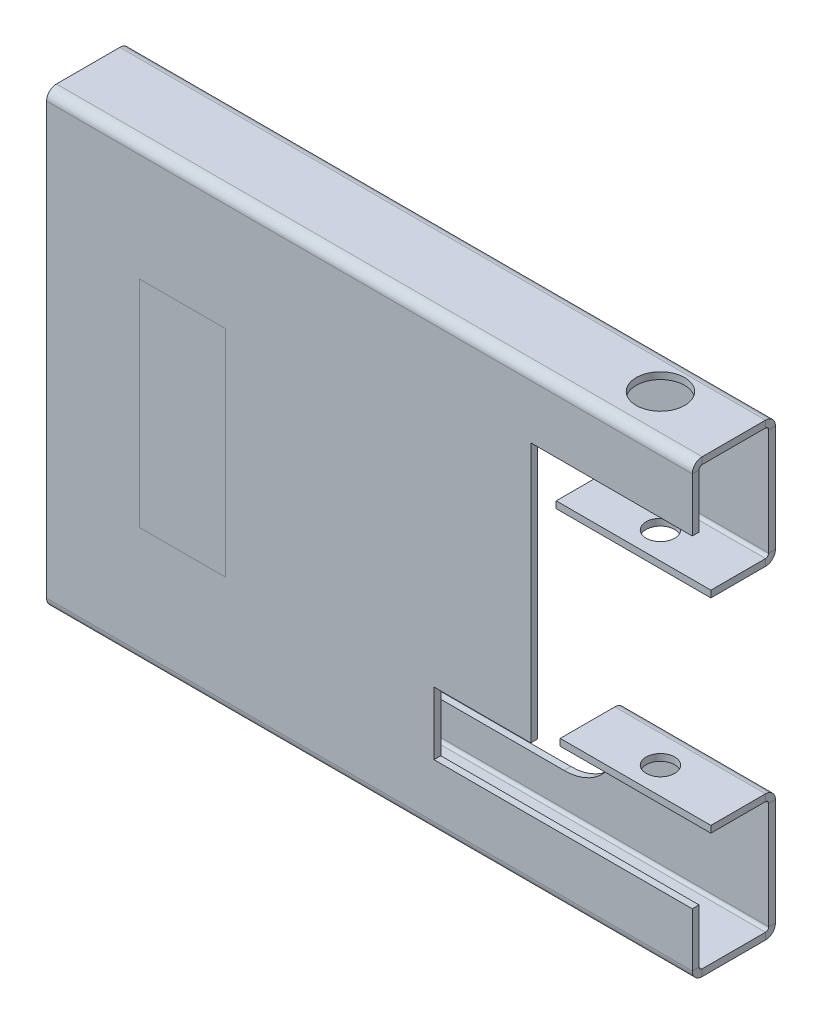
from build123d import *

# Parameters (mm, degrees)
SKETCH1_W                      = 152.4
SKETCH1_H                      = 101.6
BASE_FLANGE1_DEPTH             = 1.6002
EDGE_FLANGE1_DEPTH             = 152.4
EDGE_FLANGE2_DEPTH             = 152.4
CUT_EXTRUDE1_DEPTH             = 95.949783169
EDGE_FLANGE7_STRIP_W           = 7.874
EDGE_FLANGE7_STRIP_H           = 1.6002
EDGE_FLANGE7_STRIP_CUT_DEPTH   = 152.4
EDGE_FLANGE7_DEPTH             = 152.4
EDGE_FLANGE8_STRIP_W           = 7.874
EDGE_FLANGE8_STRIP_H           = 1.6002
EDGE_FLANGE8_STRIP_CUT_DEPTH   = 152.4
EDGE_FLANGE8_DEPTH             = 152.4
SKETCH35_W                     = 35.56
SKETCH35_H                     = 1.6002
BOSS_EXTRUDE1_DEPTH            = 19.7358
EDGE_FLANGE9_STRIP_W           = 7.874
EDGE_FLANGE9_STRIP_H           = 1.6002
EDGE_FLANGE9_STRIP_CUT_DEPTH   = 35.56
EDGE_FLANGE9_DEPTH             = 35.56
SKETCH39_W                     = 36.50996
SKETCH39_H                     = 1.6002
BOSS_EXTRUDE2_DEPTH            = 19.7358
EDGE_FLANGE10_STRIP_W          = 7.874
EDGE_FLANGE10_STRIP_H          = 1.6002
EDGE_FLANGE10_STRIP_CUT_DEPTH  = 36.50996
EDGE_FLANGE10_DEPTH            = 36.50996
CUT_EXTRUDE2_REACH             = 111.661
SKETCH43_R                     = 3.37312
CUT_EXTRUDE2_DIRECTION_2_REACH = 111.661
FILLET1_R                      = 12.7
SKETCH45_R                     = 5.715
CUT_EXTRUDE3_DEPTH             = 1.6002


# Sheet-metal steps are written as plain solids
with BuildPart() as part:
    # Sketch1 → Base-Flange1 (new body)
    with BuildSketch(Plane.XY):
        Rectangle(SKETCH1_W, SKETCH1_H)
    extrude(amount=-BASE_FLANGE1_DEPTH)

    # Edge-Flange1 section (across the edge) → Edge-Flange1 (add)
    with BuildSketch(Plane(origin=(-76.2, 51.5366, -1.6002), x_dir=(0, -1, 0), z_dir=(1, 0, 0))):
        with BuildLine():
            Line((-1.6002, 0.7366), (-1.6002, 18.034))
            Line((-1.6002, 18.034), (0, 18.034))
            Line((0, 18.034), (0, 0.7366))
            ThreePointArc((0, 0.7366), (0.215745145, 0.215745145), (0.7366, 0))
            Line((0.7366, 0), (0.7366, -1.6002))
            ThreePointArc((0.7366, -1.6002), (-0.915767126, -0.915767126), (-1.6002, 0.7366))
        make_face()
    extrude(amount=EDGE_FLANGE1_DEPTH)

    # Edge-Flange2 section (across the edge) → Edge-Flange2 (add)
    with BuildSketch(Plane(origin=(76.2, -51.5366, -1.6002), x_dir=(0, 1, 0), z_dir=(-1, 0, 0))):
        with BuildLine():
            Line((-1.6002, 0.7366), (-1.6002, 18.034))
            Line((-1.6002, 18.034), (0, 18.034))
            Line((0, 18.034), (0, 0.7366))
            ThreePointArc((0, 0.7366), (0.215745145, 0.215745145), (0.7366, 0))
            Line((0.7366, 0), (0.7366, -1.6002))
            ThreePointArc((0.7366, -1.6002), (-0.915767126, -0.915767126), (-1.6002, 0.7366))
        make_face()
    extrude(amount=EDGE_FLANGE2_DEPTH)

    # Sketch14 → Cut-Extrude1 (cut, through all)
    with BuildSketch(Plane.XY):
        Polygon((76.2, -38.1), (76.2, 38.1), (38.1, 38.1), (38.1, -23.241), (15.24, -23.241), (15.24, -38.1), align=None)
    extrude(amount=-CUT_EXTRUDE1_DEPTH, mode=Mode.SUBTRACT)

    # Edge-Flange7 strip (across the edge) → Edge-Flange7 strip cut (cut)
    with BuildSketch(Plane(origin=(76.2, -51.5366, -19.6342), x_dir=(0, 0, 1), z_dir=(-1, 0, 0))):
        with Locations((-1.6002, -0.8001)):
            Rectangle(EDGE_FLANGE7_STRIP_W, EDGE_FLANGE7_STRIP_H)
    extrude(amount=EDGE_FLANGE7_STRIP_CUT_DEPTH, mode=Mode.SUBTRACT)

    # Edge-Flange7 section (across the edge) → Edge-Flange7 (add)
    with BuildSketch(Plane(origin=(76.2, -51.5366, -19.6342), x_dir=(0, 0, 1), z_dir=(-1, 0, 0))):
        with BuildLine():
            Line((0, 0.7366), (0, 8.5598))
            Line((0, 8.5598), (1.6002, 8.5598))
            Line((1.6002, 8.5598), (1.6002, 0.7366))
            ThreePointArc((1.6002, 0.7366), (1.815945145, 0.215745145), (2.3368, 0))
            Line((2.3368, 0), (2.3368, -1.6002))
            ThreePointArc((2.3368, -1.6002), (0.684432874, -0.915767126), (0, 0.7366))
        make_face()
    extrude(amount=EDGE_FLANGE7_DEPTH)

    # Edge-Flange8 strip (across the edge) → Edge-Flange8 strip cut (cut)
    with BuildSketch(Plane(origin=(-76.2, 51.5366, -19.6342), x_dir=(0, 0, 1), z_dir=(1, 0, 0))):
        with Locations((-1.6002, -0.8001)):
            Rectangle(EDGE_FLANGE8_STRIP_W, EDGE_FLANGE8_STRIP_H)
    extrude(amount=EDGE_FLANGE8_STRIP_CUT_DEPTH, mode=Mode.SUBTRACT)

    # Edge-Flange8 section (across the edge) → Edge-Flange8 (add)
    with BuildSketch(Plane(origin=(-76.2, 51.5366, -19.6342), x_dir=(0, 0, 1), z_dir=(1, 0, 0))):
        with BuildLine():
            Line((0, 0.7366), (0, 8.5598))
            Line((0, 8.5598), (1.6002, 8.5598))
            Line((1.6002, 8.5598), (1.6002, 0.7366))
            ThreePointArc((1.6002, 0.7366), (1.815945145, 0.215745145), (2.3368, 0))
            Line((2.3368, 0), (2.3368, -1.6002))
            ThreePointArc((2.3368, -1.6002), (0.684432874, -0.915767126), (0, 0.7366))
        make_face()
    extrude(amount=EDGE_FLANGE8_DEPTH)

    # Sketch35 → Boss-Extrude1 (add)
    with BuildSketch(Plane(origin=(0, -42.9768, 0), x_dir=(1, 0, 0), z_dir=(0, 1, 0))):
        with Locations((58.42, 18.8341)):
            Rectangle(SKETCH35_W, SKETCH35_H)
    extrude(amount=BOSS_EXTRUDE1_DEPTH)

    # Edge-Flange9 strip (across the edge) → Edge-Flange9 strip cut (cut)
    with BuildSketch(Plane(origin=(76.2, -23.241, -18.034), x_dir=(0, -1, 0), z_dir=(-1, 0, 0))):
        with Locations((-1.6002, -0.8001)):
            Rectangle(EDGE_FLANGE9_STRIP_W, EDGE_FLANGE9_STRIP_H)
    extrude(amount=EDGE_FLANGE9_STRIP_CUT_DEPTH, mode=Mode.SUBTRACT)

    # Edge-Flange9 section (across the edge) → Edge-Flange9 (add)
    with BuildSketch(Plane(origin=(76.2, -23.241, -18.034), x_dir=(0, -1, 0), z_dir=(-1, 0, 0))):
        with BuildLine():
            Line((0, 0.7366), (0, 13.6398))
            Line((0, 13.6398), (1.6002, 13.6398))
            Line((1.6002, 13.6398), (1.6002, 0.7366))
            ThreePointArc((1.6002, 0.7366), (1.815945145, 0.215745145), (2.3368, 0))
            Line((2.3368, 0), (2.3368, -1.6002))
            ThreePointArc((2.3368, -1.6002), (0.684432874, -0.915767126), (0, 0.7366))
        make_face()
    extrude(amount=EDGE_FLANGE9_DEPTH)

    # Sketch39 → Boss-Extrude2 (add)
    with BuildSketch(Plane.XZ.offset(-42.9768)):
        with Locations((57.94502, -18.8341)):
            Rectangle(SKETCH39_W, SKETCH39_H)
    extrude(amount=BOSS_EXTRUDE2_DEPTH)

    # Edge-Flange10 strip (across the edge) → Edge-Flange10 strip cut (cut)
    with BuildSketch(Plane(origin=(39.69004, 23.241, -18.034), x_dir=(0, 1, 0), z_dir=(1, 0, 0))):
        with Locations((-1.6002, -0.8001)):
            Rectangle(EDGE_FLANGE10_STRIP_W, EDGE_FLANGE10_STRIP_H)
    extrude(amount=EDGE_FLANGE10_STRIP_CUT_DEPTH, mode=Mode.SUBTRACT)

    # Edge-Flange10 section (across the edge) → Edge-Flange10 (add)
    with BuildSketch(Plane(origin=(39.69004, 23.241, -18.034), x_dir=(0, 1, 0), z_dir=(1, 0, 0))):
        with BuildLine():
            Line((0, 0.7366), (0, 13.6398))
            Line((0, 13.6398), (1.6002, 13.6398))
            Line((1.6002, 13.6398), (1.6002, 0.7366))
            ThreePointArc((1.6002, 0.7366), (1.815945145, 0.215745145), (2.3368, 0))
            Line((2.3368, 0), (2.3368, -1.6002))
            ThreePointArc((2.3368, -1.6002), (0.684432874, -0.915767126), (0, 0.7366))
        make_face()
    extrude(amount=EDGE_FLANGE10_DEPTH)

    # Cut-Extrude2: up to this face of the body (flat: up to its plane)
    cut_extrude2_end = Plane(part.part.faces().sort_by_distance((58.42, -24.8412, -10.8458))[0])
    # Sketch43 → Cut-Extrude2 (cut, up to the picked face)
    with BuildSketch(Plane(origin=(0, -23.241, 0), x_dir=(1, 0, 0), z_dir=(0, 1, 0)), mode=Mode.PRIVATE) as cut_extrude2_sk1:
        with Locations(Location((57.94502, 10.7442, 0), (0, 0, 270))):
            Circle(SKETCH43_R)
    cut_extrude2_tool1 = split(extrude(cut_extrude2_sk1.sketch, amount=-CUT_EXTRUDE2_REACH, mode=Mode.PRIVATE), bisect_by=cut_extrude2_end, keep=Keep.BOTH, mode=Mode.PRIVATE)
    add(cut_extrude2_tool1.solids().sort_by(Axis((57.94502, -23.241, -10.7442), (0, -1, 0)))[0], mode=Mode.SUBTRACT)

    # Cut-Extrude2 direction 2: up to this face of the body (flat: up to its plane)
    cut_extrude2_direction_2_end = Plane(part.part.faces().sort_by_distance((57.94502, 24.8412, -10.8458))[0])
    # Sketch43 → Cut-Extrude2 direction 2 (cut, up to the picked face)
    with BuildSketch(Plane(origin=(0, -23.241, 0), x_dir=(1, 0, 0), z_dir=(0, 1, 0)), mode=Mode.PRIVATE) as cut_extrude2_direction_2_sk1:
        with Locations(Location((57.94502, 10.7442, 0), (0, 0, 270))):
            Circle(SKETCH43_R)
    cut_extrude2_direction_2_tool1 = split(extrude(cut_extrude2_direction_2_sk1.sketch, amount=CUT_EXTRUDE2_DIRECTION_2_REACH, mode=Mode.PRIVATE), bisect_by=cut_extrude2_direction_2_end, keep=Keep.BOTH, mode=Mode.PRIVATE)
    add(cut_extrude2_direction_2_tool1.solids().sort_by(Axis((57.94502, -23.241, -10.7442), (0, 1, 0)))[0], mode=Mode.SUBTRACT)

    # Fillet1
    fillet1_edges = [part.edges().sort_by_distance(p)[0] for p in [
        (40.64, -42.9768, -18.8341),
        (39.69004, 42.9768, -18.8341),
    ]]
    fillet(fillet1_edges, radius=FILLET1_R)

    # Sketch45 → Cut-Extrude3 (cut)
    with BuildSketch(Plane(origin=(0, 53.1368, 0), x_dir=(1, 0, 0), z_dir=(0, 1, 0))):
        with Locations(Location((57.94502, 10.7442, 0), (0, 0, 270))):
            Circle(SKETCH45_R)
    extrude(amount=-CUT_EXTRUDE3_DEPTH, mode=Mode.SUBTRACT)


solid = part.part
